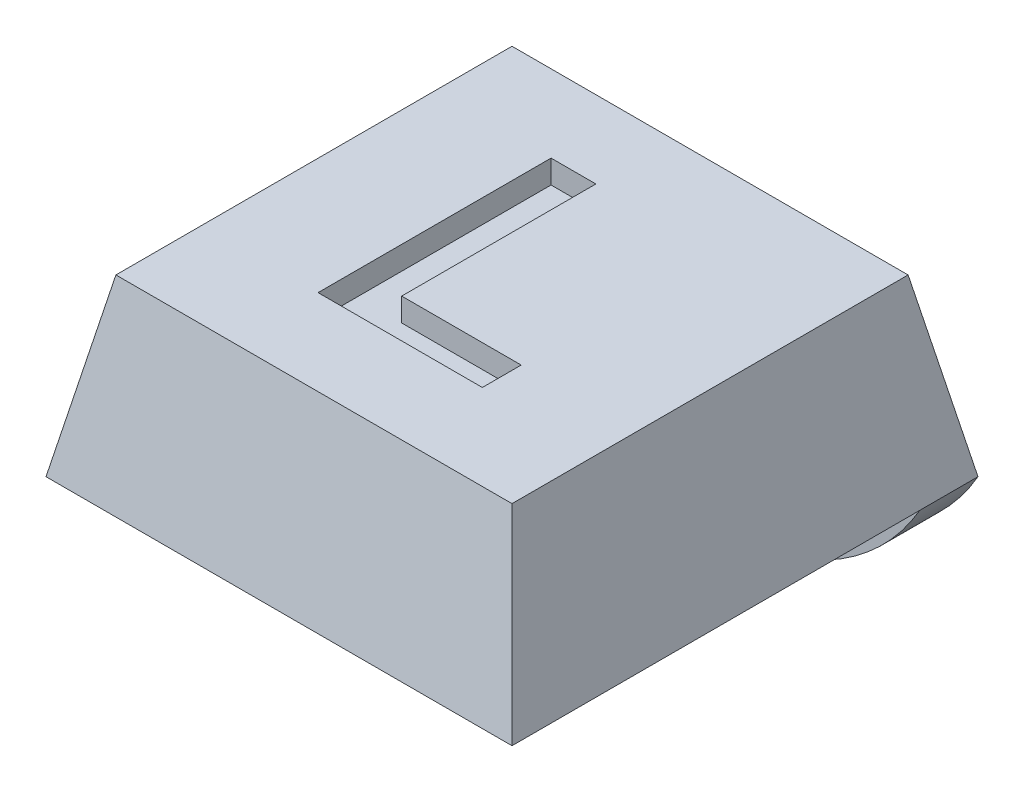
from build123d import *

# Parameters (mm, degrees)
SKETCH1_W               = 8
SKETCH1_H               = 8
BOSS_EXTRUDE1_DEPTH     = 3
CUT_EXTRUDE1_DEPTH      = 12.704699911
CUT_EXTRUDE1_DEPTH_BACK = 12.704699911
CUT_EXTRUDE2_DEPTH      = 11
SKETCH4_R               = 1.75
CUT_EXTRUDE3_DEPTH      = 0.4
SKETCH5_W               = 8
SKETCH5_H               = 1
BOSS_EXTRUDE2_DEPTH     = 2
FILLET1_R               = 4
CUT_EXTRUDE4_DEPTH      = 0.4


with BuildPart() as part:
    # Sketch1 → Boss-Extrude1 (new body)
    with BuildSketch(Plane(origin=(0, 0, 0), x_dir=(1, 0, 0), z_dir=(0, 1, 0))):
        with Locations((4, 4)):
            Rectangle(SKETCH1_W, SKETCH1_H)
    extrude(amount=BOSS_EXTRUDE1_DEPTH)

    # Sketch2 → Cut-Extrude1 (cut, two sides: drawn at the far end of the back side and taken through both)
    with BuildSketch(Plane.XY.offset(-CUT_EXTRUDE1_DEPTH_BACK)):
        Polygon((0, 0), (0.6, 3), (0, 3), align=None)
        Polygon((8, 0), (7.4, 3), (8, 3), align=None)
    extrude(amount=CUT_EXTRUDE1_DEPTH + CUT_EXTRUDE1_DEPTH_BACK, mode=Mode.SUBTRACT)

    # Sketch3 → Cut-Extrude2 (cut)
    with BuildSketch(Plane(origin=(0, 0, 0), x_dir=(0, 0, -1), z_dir=(1, 0, 0))):
        Polygon((0, 0), (0.6, 3), (0, 3), align=None)
        Polygon((8, 3), (7.4, 3), (8, 0), align=None)
    extrude(amount=CUT_EXTRUDE2_DEPTH, mode=Mode.SUBTRACT)

    # Sketch4 → Cut-Extrude3 (cut)
    with BuildSketch(Plane.XZ):
        with Locations(Location((4, -3.75, 0), (0, 0, 270))):
            Circle(SKETCH4_R)
    extrude(amount=-CUT_EXTRUDE3_DEPTH, mode=Mode.SUBTRACT)

    # Sketch5 → Boss-Extrude2 (add)
    with BuildSketch(Plane.XZ):
        with Locations((4, -7.5)):
            Rectangle(SKETCH5_W, SKETCH5_H)
    extrude(amount=BOSS_EXTRUDE2_DEPTH)

    # Fillet1
    # the kernel refuses this fillet: 4 mm, written as the material it takes off along each edge
    with BuildSketch(Plane(origin=(8, -2, -16.660254038), x_dir=(0, 1, 0), z_dir=(0, 0, 1)), Plane(origin=(0, -2, 1.660254038), x_dir=(0, 1, 0), z_dir=(0, 0, -1))) as fillet1_piece_1:
        with BuildLine():
            CenterArc((4, 3.464101615), FILLET1_R, 180, 60)
            Line((0, 3.464101615), (-0.08, 3.464101615))
            Line((-0.08, 3.464101615), (-0.08, 0))
            Line((-0.08, 0), (0, -0.08))
            ThreePointArc((0, -0.08), (1, -0.08), (1.96, -0.069282032))
            Line((1.96, -0.069282032), (2, 0))
        make_face()
    extrude(amount=18.320508076, mode=Mode.SUBTRACT)

    # Sketch6 → Cut-Extrude4 (cut)
    with BuildSketch(Plane(origin=(0, 3, 0), x_dir=(1, 0, 0), z_dir=(0, 1, 0))):
        Polygon((2.598201218, 2.07225421), (2.598201218, 6.07225421), (3.367431987, 6.07225421), (3.367431987, 2.738920877), (5.418714038, 2.738920877), (5.418714038, 2.07225421), align=None)
    extrude(amount=-CUT_EXTRUDE4_DEPTH, mode=Mode.SUBTRACT)


solid = part.part
